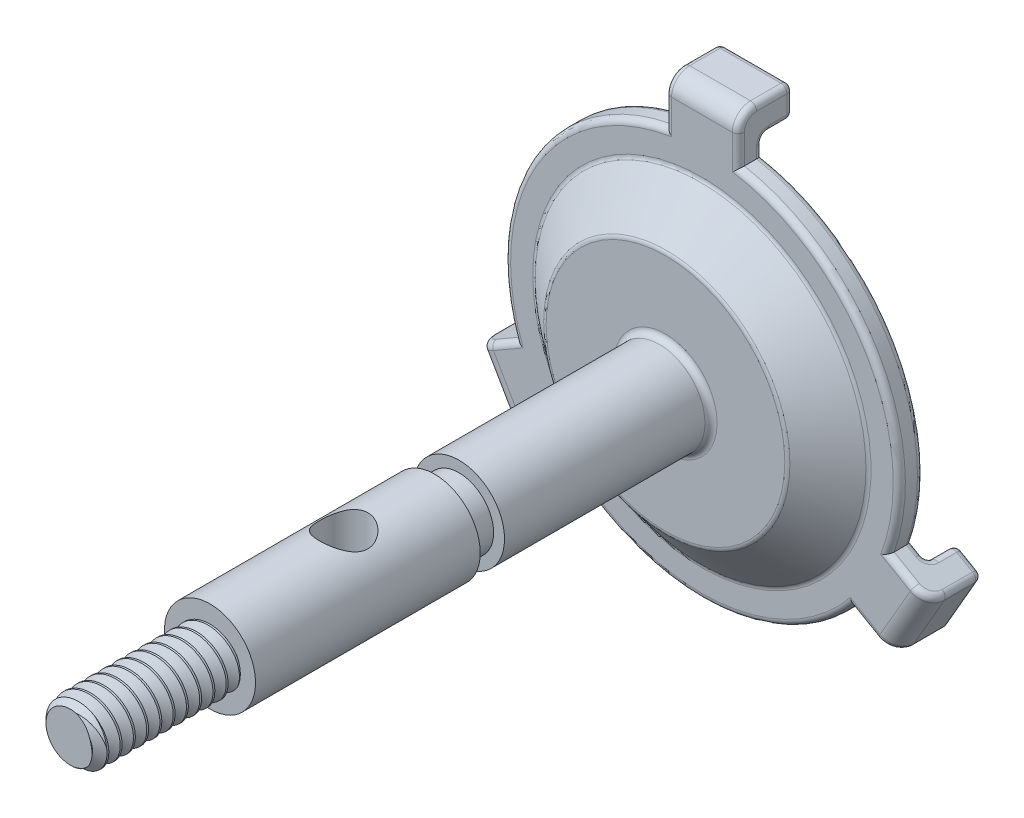
from build123d import *

# Parameters (mm, degrees)
SKETCH2_W                          = 3.048
SKETCH2_H                          = 1.9812
FLANGE_A_DEPTH                     = 1.016
SKETCH3_W                          = 3.048
SKETCH3_H                          = 1.27
FLANGE_B_DEPTH                     = 1.27
CIRCULAR_PATTERN_FOR_FLANGES_COUNT = 3
SHAFT_HOLE_DEPTH                   = 29.603669046
SHAFT_HOLE_DEPTH_BACK              = 29.603669046
SKETCH4_R                          = 1.016
TIP_CHAMFER_SIZE                   = 0.254
THREAD_CUT_PITCH                   = 0.554181818
THREAD_CUT_FROM                    = 0
FLANGE_FILLETS_R                   = 0.762
SURFACE_FILLET_R                   = 0.254


with BuildPart() as part:
    # Sketch1 → Base revolve (revolve)
    with BuildSketch(Plane(origin=(0, 0, 0), x_dir=(0, 0, -1), z_dir=(1, 0, 0)), mode=Mode.PRIVATE) as base_revolve_sk:
        Polygon((0.889, 2.286), (3.81, 2.286), (3.81, 0), (0, 0), (-25.019, 0), (-25.019, 1.27), (-19.177, 1.27), (-19.177, 1.905), (-9.779, 1.905), (-9.779, 1.4478), (-8.763, 1.4478), (-8.763, 1.905), (-0.127, 1.905), (-0.127, 5.08), (1.397, 6.985), (1.397, 8.255), (2.413, 8.255), (2.413, 6.985), (0.889, 5.08), align=None)
    revolve(base_revolve_sk.sketch.rotate(Axis((0, 0, 9.149772727), (0, 0, -1)), 90), axis=Axis((0, 0, 9.149772727), (0, 0, -1)))

    # Sketch2 → Flange A (add)
    with BuildSketch(Plane(origin=(0, 0, -2.413), x_dir=(-1, 0, 0), z_dir=(0, 0, -1))):
        with Locations((0, 9.103703537)):
            Rectangle(SKETCH2_W, SKETCH2_H)
    flange_a = extrude(amount=-FLANGE_A_DEPTH)

    # Sketch3 → Flange B (add)
    with BuildSketch(Plane(origin=(0, 0, -2.413), x_dir=(-1, 0, 0), z_dir=(0, 0, -1))):
        with Locations((0, 9.459303537)):
            Rectangle(SKETCH3_W, SKETCH3_H)
    flange_b = extrude(amount=FLANGE_B_DEPTH)

    # Circular pattern for flanges: Flange A, Flange B ×3 about axis
    circular_pattern_for_flanges_axis = Axis((0, 0, 0), (0, 0, 1))
    add([flange_a.rotate(circular_pattern_for_flanges_axis, i * 360 / CIRCULAR_PATTERN_FOR_FLANGES_COUNT) for i in range(1, CIRCULAR_PATTERN_FOR_FLANGES_COUNT)])
    add([flange_b.rotate(circular_pattern_for_flanges_axis, i * 360 / CIRCULAR_PATTERN_FOR_FLANGES_COUNT) for i in range(1, CIRCULAR_PATTERN_FOR_FLANGES_COUNT)])

    # Sketch4 → Shaft hole (cut, two sides: drawn at the far end of the back side and taken through both)
    with BuildSketch(Plane(origin=(0, 0, 0), x_dir=(1, 0, 0), z_dir=(0, 1, 0)).offset(-SHAFT_HOLE_DEPTH_BACK)):
        with Locations(Location((0, -13.589, 0), (0, 0, 270))):
            Circle(SKETCH4_R)
    extrude(amount=SHAFT_HOLE_DEPTH + SHAFT_HOLE_DEPTH_BACK, mode=Mode.SUBTRACT)

    # Tip chamfer
    tip_chamfer_edges = [part.edges().sort_by_distance(p)[0] for p in [
        (-1.27, 0, 25.019),
    ]]
    chamfer(tip_chamfer_edges, length=TIP_CHAMFER_SIZE)

    # Thread cut: arcs per turn and ends read off the stored shape
    # Thread cut: the profile of Sketch7 profile screwed along a right-hand helix through 12 turns, 6 arcs to a turn; built about Z, then put on its axis
    thread_cut_z = Axis((0, 0, 0), (0, 0, 1))
    thread_cut_corners = [(1.2703, 0, -0.792480023), (0.885051708, 0, -0.570056818), (0.885051708, 0, -0.538306818), (1.2703, 0, -0.315883613)]
    with BuildLine(mode=Mode.PRIVATE) as thread_cut_profile:
        Line(thread_cut_corners[0], thread_cut_corners[1])
        Line(thread_cut_corners[1], thread_cut_corners[2])
        Line(thread_cut_corners[2], thread_cut_corners[3])
        Line(thread_cut_corners[3], thread_cut_corners[0])
    thread_cut_cap = Face(thread_cut_profile.wire())
    thread_cut_turn_angles = [0, 30, 60, 90, 120, 150, 180, 210, 240, 270, 300, 330, 360]
    thread_cut_turn_weights = [1, 0.8660254037844387, 1, 0.8660254037844387, 1, 0.8660254037844387, 1, 0.8660254037844387, 1, 0.8660254037844387, 1, 0.8660254037844387, 1]
    thread_cut_turn_rails = [Edge.make_bspline([Vector(p[0], p[1], 0).rotate(thread_cut_z, thread_cut_turn_angles[k]) / thread_cut_turn_weights[k] + Vector(0, 0, p[2] + THREAD_CUT_PITCH * thread_cut_turn_angles[k] / 360) for k in range(13)], [0, 0, 0, 1, 1, 2, 2, 3, 3, 4, 4, 5, 5, 6, 6, 6], 2, thread_cut_turn_weights) for p in thread_cut_corners]
    thread_cut_turn_sides = [Face.make_surface_from_curves(thread_cut_turn_rails[p[0]], thread_cut_turn_rails[p[1]]) for p in [(0, 1), (1, 2), (2, 3), (3, 0)]]
    thread_cut = Plane(origin=(0, 0, 19.177), x_dir=(-1, 0, 0), z_dir=(0, 0, 1)) * split(Solid(Shell([*[p.moved(Location((0, 0, THREAD_CUT_PITCH * i))) for i in range(12) for p in thread_cut_turn_sides], thread_cut_cap, thread_cut_cap.rotate(thread_cut_z, 4320).moved(Location((0, 0, THREAD_CUT_PITCH * 4320 / 360)))])), bisect_by=Plane.XY.offset(THREAD_CUT_FROM), keep=Keep.TOP, mode=Mode.PRIVATE)
    add(thread_cut, mode=Mode.SUBTRACT)

    # Flange fillets
    flange_fillets_edges = [part.edges().sort_by_distance(p)[0] for p in [
        (0, 10.094303537, -1.397),
        (-8.741923296, -5.047151768, -1.397),
        (8.741923296, -5.047151768, -1.397),
    ]]
    fillet(flange_fillets_edges, radius=FLANGE_FILLETS_R)

    # Surface fillet
    surface_fillet_edges = [part.edges().sort_by_distance(p)[0] for p in [
        (6.5721124, -5.554174484, -2.413),
        (8.404071034, -3.092329053, -3.048),
        (7.642071034, -4.412151768, -2.413),
        (6.880071034, -5.731974484, -3.048),
        (8.953997165, -3.409829053, -3.683),
        (8.741923296, -5.047151768, -3.683),
        (7.429997165, -6.049474484, -3.683),
        (7.642071034, -4.412151768, -3.683),
        (-6.985, 0, -2.413),
        (-6.985, 0, -1.397),
        (-5.08, 0, 0.127),
        (-1.905, 0, 0.127),
        (8.316082853, -3.041529053, -1.397),
        (-1.524, 8.722703537, -1.397),
        (-6.792082853, -5.681174484, -1.397),
        (-7.979923296, -6.366974484, -2.921),
        (-7.786639735, -6.255382167, -1.620184633),
        (-9.503923296, -3.727329053, -2.921),
        (-9.310639735, -3.615736737, -1.620184633),
        (9.503923296, -3.727329053, -2.921),
        (9.310639735, -3.615736737, -1.620184633),
        (7.979923296, -6.366974484, -2.921),
        (7.786639735, -6.255382167, -1.620184633),
        (-1.524, 10.094303537, -2.921),
        (-1.524, 9.871118904, -1.620184633),
        (1.524, 10.094303537, -2.921),
        (1.524, 9.871118904, -1.620184633),
        (-7.149039708, 4.1275, -2.413),
        (-7.149039708, 4.1275, -1.397),
        (-1.524, 8.468703537, -2.413),
        (1.524, 8.722703537, -1.397),
        (1.524, 8.468703537, -2.413),
        (-1.524, 8.824303537, -3.048),
        (0, 8.824303537, -2.413),
        (1.524, 8.824303537, -3.048),
        (-1.524, 9.459303537, -3.683),
        (0, 10.094303537, -3.683),
        (1.524, 9.459303537, -3.683),
        (0, 8.824303537, -3.683),
        (0, -8.255, -1.397),
        (0, -8.255, -2.413),
        (-6.5721124, -5.554174484, -2.413),
        (-8.316082853, -3.041529053, -1.397),
        (7.149039708, 4.1275, -1.397),
        (7.149039708, 4.1275, -2.413),
        (8.0961124, -2.914529053, -2.413),
        (6.792082853, -5.681174484, -1.397),
        (-8.0961124, -2.914529053, -2.413),
        (-6.880071034, -5.731974484, -3.048),
        (-7.642071034, -4.412151768, -2.413),
        (-8.404071034, -3.092329053, -3.048),
        (-7.429997165, -6.049474484, -3.683),
        (-8.741923296, -5.047151768, -3.683),
        (-8.953997165, -3.409829053, -3.683),
        (-7.642071034, -4.412151768, -3.683),
    ]]
    fillet(surface_fillet_edges, radius=SURFACE_FILLET_R)


solid = part.part
